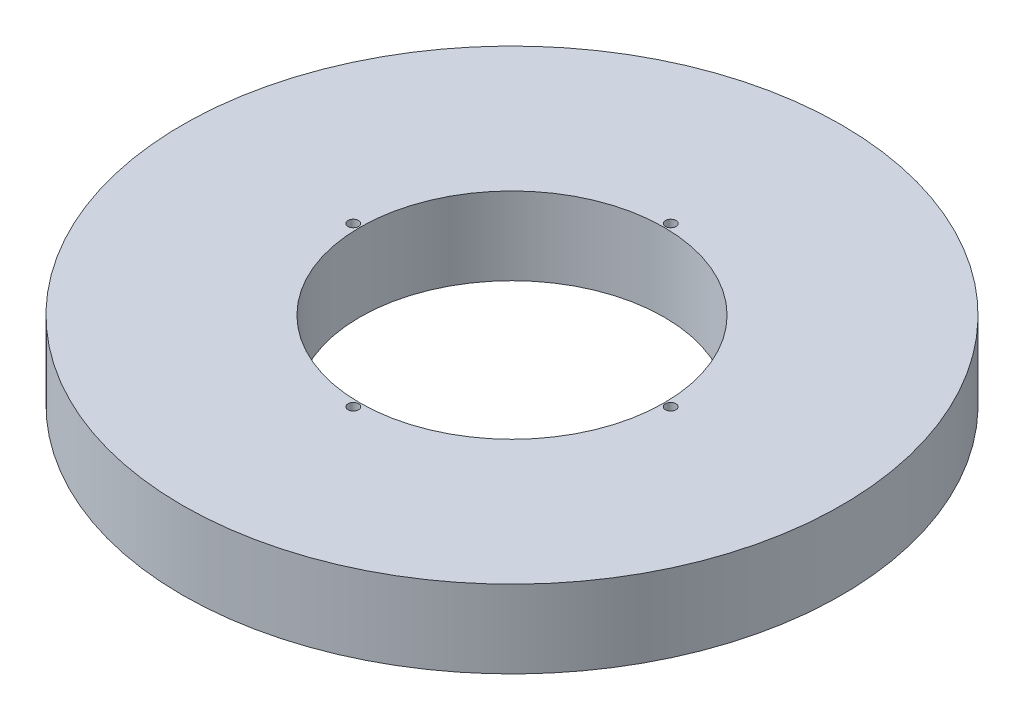
from build123d import *

# Parameters (mm, degrees)
SKETCH1_R           = 97.5
BOSS_EXTRUDE1_DEPTH = 23
SKETCH2_R           = 45
CUT_EXTRUDE1_DEPTH  = 140.790915299
SKETCH3_R           = 1.555908109
CUT_EXTRUDE2_DEPTH  = 18.361746921
CIRPATTERN1_COUNT   = 4


with BuildPart() as part:
    # Sketch1 → Boss-Extrude1 (new body)
    with BuildSketch(Plane(origin=(0, 0, 0), x_dir=(1, 0, 0), z_dir=(0, 1, 0))):
        Circle(SKETCH1_R)
    extrude(amount=BOSS_EXTRUDE1_DEPTH)

    # Sketch2 → Cut-Extrude1 (cut, through all)
    with BuildSketch(Plane(origin=(0, 0, 0), x_dir=(1, 0, 0), z_dir=(0, 1, 0))):
        Circle(SKETCH2_R)
    extrude(amount=CUT_EXTRUDE1_DEPTH, mode=Mode.SUBTRACT)

    # Sketch3 → Cut-Extrude2 (cut)
    with BuildSketch(Plane(origin=(0, 23, 0), x_dir=(1, 0, 0), z_dir=(0, 1, 0))):
        with Locations((-46.949843924, 0)):
            Circle(SKETCH3_R)
    cut_extrude2 = extrude(amount=-CUT_EXTRUDE2_DEPTH, mode=Mode.SUBTRACT)

    # CirPattern1: Cut-Extrude2 ×4 about axis
    cirpattern1_axis = Axis((0, 0, 0), (0, 1, 0))
    for i in range(1, CIRPATTERN1_COUNT):
        add(cut_extrude2.rotate(cirpattern1_axis, i * 360 / CIRPATTERN1_COUNT), mode=Mode.SUBTRACT)


solid = part.part
